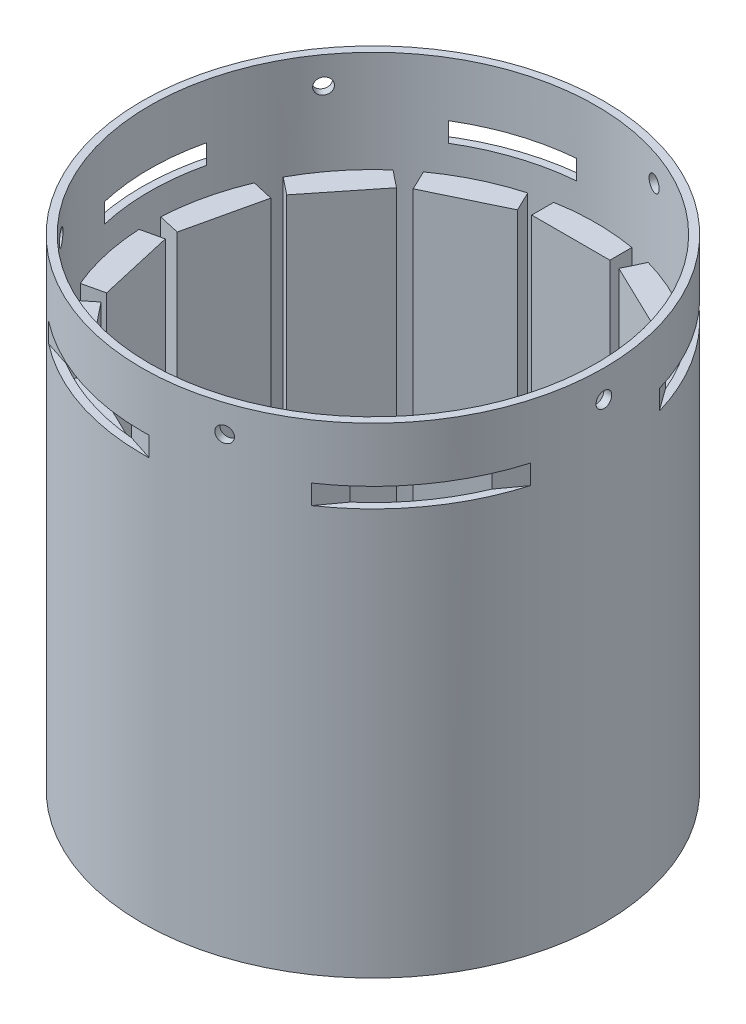
from build123d import *

# Parameters (mm, degrees)
SKETCH1_R           = 29.575
SKETCH1_R_2         = 28.575
BOSS_EXTRUDE1_DEPTH = 61.5
BOSS_EXTRUDE2_START = 2.5
BOSS_EXTRUDE2_DEPTH = 46.5
CIRPATTERN1_COUNT   = 14
SKETCH4_W           = 1.75
SKETCH4_H           = 2.5
CUT_EXTRUDE1_DEPTH  = 91.308654762
CIRPATTERN2_COUNT   = 5
SKETCH5_R           = 1
CUT_EXTRUDE2_DEPTH  = 5
CIRPATTERN3_COUNT   = 5


with BuildPart() as part:
    # Sketch1 → Boss-Extrude1 (new body)
    with BuildSketch(Plane(origin=(0, 0, 0), x_dir=(1, 0, 0), z_dir=(0, 1, 0))):
        Circle(SKETCH1_R)
        Circle(SKETCH1_R_2, mode=Mode.SUBTRACT)
    extrude(amount=BOSS_EXTRUDE1_DEPTH)

    # Sketch2 → Boss-Extrude2 (add)
    with BuildSketch(Plane(origin=(0, 4.5, 0), x_dir=(-1, 0, 0), z_dir=(0, -1, 0)).offset(BOSS_EXTRUDE2_START)):
        with BuildLine():
            Line((-5, 28.134154066), (-5, 25.325))
            Line((-5, 25.325), (5, 25.325))
            Line((5, 25.325), (5, 28.575))
            Line((5, 28.575), (0, 28.575))
            ThreePointArc((0, 28.575), (-2.509698445, 28.464575154), (-5, 28.134154066))
        make_face()
    boss_extrude2 = extrude(amount=-BOSS_EXTRUDE2_DEPTH)

    # CirPattern1: Boss-Extrude2 ×14 about axis
    cirpattern1_axis = Axis((0, 0, 0), (0, 1, 0))
    for i in range(1, CIRPATTERN1_COUNT):
        add(boss_extrude2.rotate(cirpattern1_axis, i * 360 / CIRPATTERN1_COUNT))

    # Sketch4 → Cut-Extrude1 (cut, through all)
    with BuildSketch(Plane.XY.offset(29.575)):
        with Locations((-28.7, 53.25)):
            Rectangle(SKETCH4_W, SKETCH4_H)
    cut_extrude1 = extrude(amount=-CUT_EXTRUDE1_DEPTH, mode=Mode.SUBTRACT)

    # CirPattern2: Cut-Extrude1 ×5 about axis
    cirpattern2_axis = Axis((0, 0, 0), (0, 1, 0))
    for i in range(1, CIRPATTERN2_COUNT):
        add(cut_extrude1.rotate(cirpattern2_axis, i * 360 / CIRPATTERN2_COUNT), mode=Mode.SUBTRACT)

    # Sketch5 → Cut-Extrude2 (cut, symmetric)
    with BuildSketch(Plane(origin=(8.776688534, 0, 27.011869813), x_dir=(-0.9510565162951524, 0, 0.30901699437495134), z_dir=(-0.30901699437495134, 0, -0.9510565162951524))):
        with Locations((0, 58)):
            Circle(SKETCH5_R)
    cut_extrude2 = extrude(amount=CUT_EXTRUDE2_DEPTH, both=True, mode=Mode.SUBTRACT)

    # CirPattern3: Cut-Extrude2 ×5 about axis
    cirpattern3_axis = Axis((0, 0, 0), (0, 1, 0))
    for i in range(1, CIRPATTERN3_COUNT):
        add(cut_extrude2.rotate(cirpattern3_axis, i * 360 / CIRPATTERN3_COUNT), mode=Mode.SUBTRACT)


solid = part.part
